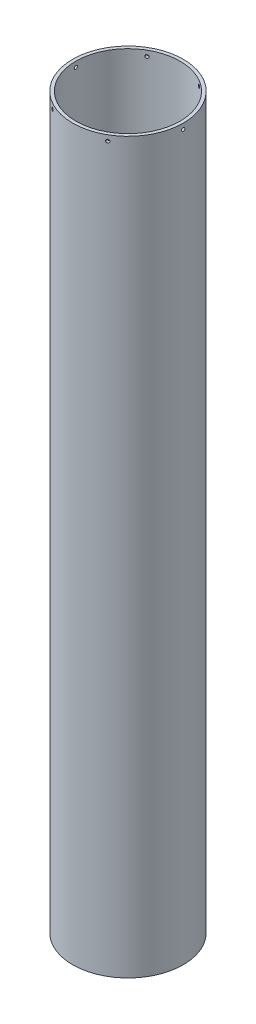
from build123d import *

# Parameters (mm, degrees)
SKETCH1_R           = 53.975
SKETCH1_R_2         = 50.8
BOSS_EXTRUDE1_DEPTH = 711.2
SKETCH2_R           = 1.5875
CUT_EXTRUDE1_DEPTH  = 716.284587594
CIRPATTERN1_COUNT   = 3


with BuildPart() as part:
    # Sketch1 → Boss-Extrude1 (new body)
    with BuildSketch(Plane(origin=(0, 0, 0), x_dir=(1, 0, 0), z_dir=(0, 1, 0))):
        Circle(SKETCH1_R)
        Circle(SKETCH1_R_2, mode=Mode.SUBTRACT)
    extrude(amount=BOSS_EXTRUDE1_DEPTH)

    # Sketch2 → Cut-Extrude1 (cut, symmetric)
    with BuildSketch(Plane(origin=(0, 0, 0), x_dir=(0, 0, -1), z_dir=(1, 0, 0))):
        with Locations((0, 705.84695)):
            Circle(SKETCH2_R)
    cut_extrude1 = extrude(amount=CUT_EXTRUDE1_DEPTH, both=True, mode=Mode.SUBTRACT)

    # CirPattern1: Cut-Extrude1 ×3 about axis
    cirpattern1_axis = Axis((0, 711.2, 0), (0, 1, 0))
    for i in range(1, CIRPATTERN1_COUNT):
        add(cut_extrude1.rotate(cirpattern1_axis, i * 360 / CIRPATTERN1_COUNT), mode=Mode.SUBTRACT)


solid = part.part
